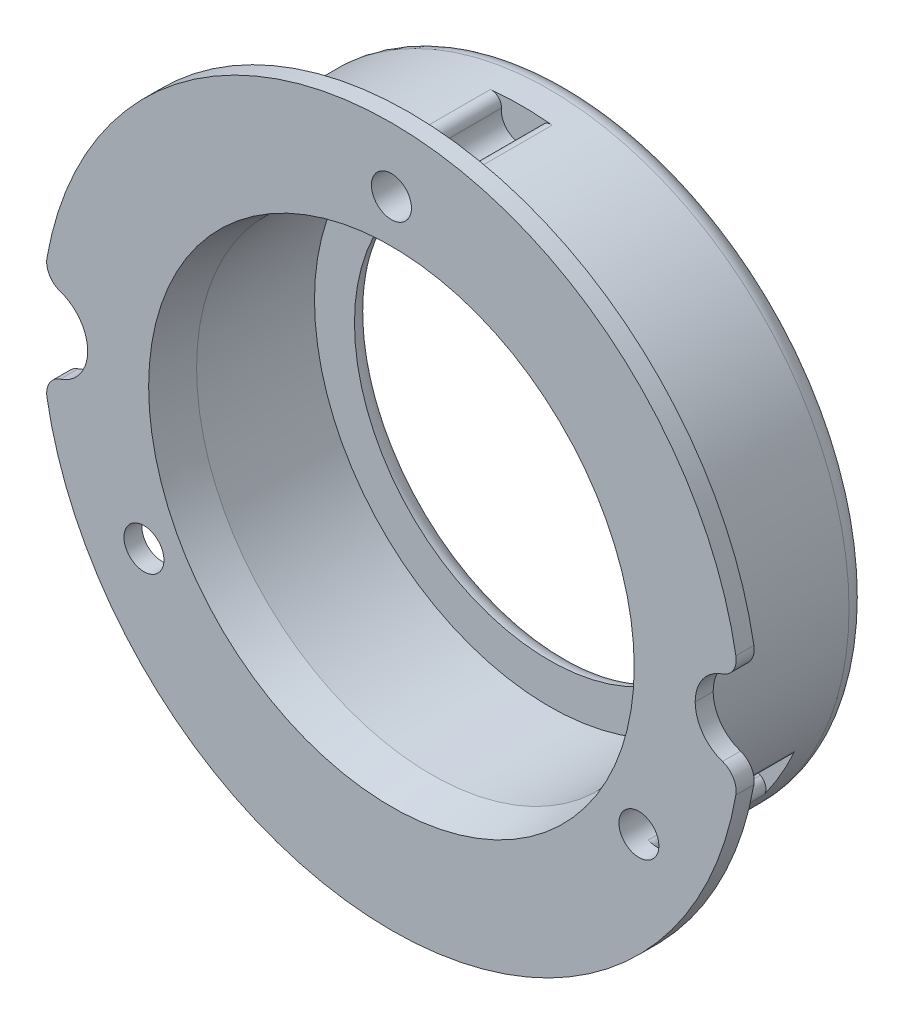
from build123d import *

# Parameters (mm, degrees)
SKETCH_1_R               = 15
SKETCH_1_R_2             = 11.75
EXTRUDE_1_DEPTH          = 4
SKETCH_2_R               = 11.75
SKETCH_2_R_2             = 9.75
EXTRUDE_2_DEPTH          = 1
FILLET_1_R               = 1
FILLET_2_R               = 1
SKETCH_3_R               = 17.5
SKETCH_3_R_2             = 11.75
EXTRUDE_3_DEPTH          = 0.9
CUT_EXTRUDE_1_DEPTH      = 27.009613607
FILLET_3_R               = 2
FILLET_4_R               = 1
SKETCH_6_R               = 1
CUT_EXTRUDE_2_DEPTH      = 6.5
PATTERN_CIRCULAR_2_COUNT = 3
FILLET_6_R               = 0.5
CHAMFER_1_SIZE           = 0.4
CHAMFER_1_SIZE2          = 2


# Some blends are built 0.0001 mm under size
with BuildPart() as part:
    # 草图1 → 凸台-拉伸1 (new, symmetric)
    with BuildSketch(Plane.XY):
        Circle(SKETCH_1_R)
        Circle(SKETCH_1_R_2, mode=Mode.SUBTRACT)
    extrude(amount=EXTRUDE_1_DEPTH, both=True)

    # 草图2 → 凸台-拉伸2 (add)
    with BuildSketch(Plane(origin=(0, 0, -4), x_dir=(-1, 0, 0), z_dir=(0, 0, -1))):
        Circle(SKETCH_2_R)
        Circle(SKETCH_2_R_2, mode=Mode.SUBTRACT)
    extrude(amount=-EXTRUDE_2_DEPTH)

    # 圆角1
    fillet_1_edges = [part.edges().sort_by_distance(p)[0] for p in [
        (-15, 0, -4),
    ]]
    fillet(fillet_1_edges, radius=FILLET_1_R)

    # 圆角2
    fillet_2_edges = [part.edges().sort_by_distance(p)[0] for p in [
        (9.75, 0, -4),
    ]]
    fillet(fillet_2_edges, radius=FILLET_2_R - 0.0001)  # a hair under: the kernel refuses the full size

    # 草图3 → 凸台-拉伸3 (add)
    with BuildSketch(Plane.XY.offset(4)):
        Circle(SKETCH_3_R)
        with Locations(Location((0, 0, 0), (0, 0, 180))):
            Circle(SKETCH_3_R_2, mode=Mode.SUBTRACT)
    extrude(amount=EXTRUDE_3_DEPTH)

    # 草图4 → 切除-拉伸1 (cut, through all)
    with BuildSketch(Plane(origin=(0, 0, 4), x_dir=(-1, 0, 0), z_dir=(0, 0, -1))):
        with BuildLine():
            Line((-20.056660766, 2), (-15.067846561, 2))
            ThreePointArc((-15.067846561, 2), (-15.2, 0), (-15.067846561, -2))
            Line((-15.067846561, -2), (-20.056660766, -2))
            Line((-20.056660766, -2), (-20.056660766, 2))
        make_face()
    cut_extrude_1 = extrude(amount=-CUT_EXTRUDE_1_DEPTH, mode=Mode.SUBTRACT)

    # 镜向1: 切除-拉伸1 across plane
    add(cut_extrude_1.mirror(Plane(origin=(0, 0, 0), x_dir=(0, 0, 1), z_dir=(1, 0, 0))), mode=Mode.SUBTRACT)

    # 圆角3
    fillet_3_edges = [part.edges().sort_by_distance(p)[0] for p in [
        (-15.067846561, -2, 4.45),
        (-15.067846561, 2, 4.45),
        (15.067846561, -2, 4.45),
        (15.067846561, 2, 4.45),
    ]]
    fillet(fillet_3_edges, radius=FILLET_3_R - 0.0001)  # a hair under: the kernel refuses the full size

    # 圆角4
    fillet_4_edges = [part.edges().sort_by_distance(p)[0] for p in [
        (17.385338651, 2, 4.45),
        (17.385338651, -2, 4.45),
        (-17.385338651, -2, 4.45),
        (-17.385338651, 2, 4.45),
    ]]
    fillet(fillet_4_edges, radius=FILLET_4_R)

    # 草图6 → 切除-拉伸2 (cut)
    with BuildSketch(Plane.XY.offset(4.9)):
        with Locations((0, 14.3)):
            Circle(SKETCH_6_R)
    cut_extrude_2 = extrude(amount=-CUT_EXTRUDE_2_DEPTH, mode=Mode.SUBTRACT)

    # 阵列(圆周)2: 切除-拉伸2 ×3 about axis
    pattern_circular_2_axis = Axis((0, 0, 0), (0, 0, 1))
    for i in range(1, PATTERN_CIRCULAR_2_COUNT):
        add(cut_extrude_2.rotate(pattern_circular_2_axis, i * 360 / PATTERN_CIRCULAR_2_COUNT), mode=Mode.SUBTRACT)

    # 圆角6
    # the kernel refuses this fillet: 0.5 mm, written as the material it takes off along each edge
    with BuildSketch(Plane(origin=(-0.73119563, 14.982167832, -1.6), x_dir=(-0.997111465428935, -0.07595212643607639, 0), z_dir=(0, 0, 1)), Plane(origin=(13.340535761, -6.857849926, -1.6), x_dir=(0.4327792617493751, 0.9014999226842262, 0), z_dir=(0, 0, 1)), Plane(origin=(-12.609340132, -8.124317906, -1.6), x_dir=(0.5643322036795584, -0.8255477962481478, 0), z_dir=(0, 0, 1))) as fillet_6_piece_1:
        with BuildLine():
            CenterArc((0.804059787, 0.49981424), FILLET_6_R, 170.950986261, 100.610876057)
            ThreePointArc((0.310282709, 0.578453903), (0.203956844, 0.26304232), (0, 0))
            ThreePointArc((0, 0), (0.40884396, -0.005572815), (0.817687919, 0))
        make_face()
    extrude(amount=5.6, mode=Mode.SUBTRACT)
    with BuildSketch(Plane(origin=(0.73119563, 14.982167832, -1.6), x_dir=(0.997111465428935, -0.07595212643607635, 0), z_dir=(0, 0, 1)), Plane(origin=(12.609340132, -8.124317906, -1.6), x_dir=(-0.5643322036795624, -0.825547796248145, 0), z_dir=(0, 0, 1)), Plane(origin=(-13.340535761, -6.857849926, -1.6), x_dir=(-0.4327792617493753, 0.9014999226842261, 0), z_dir=(0, 0, 1))) as fillet_6_piece_2:
        with BuildLine():
            CenterArc((0.804059787, -0.49981424), FILLET_6_R, 88.438137682, 100.610876057)
            ThreePointArc((0.310282709, -0.578453903), (0.203956844, -0.26304232), (0, 0))
            ThreePointArc((0, 0), (0.40884396, 0.005572815), (0.817687919, 0))
        make_face()
    extrude(amount=5.6, mode=Mode.SUBTRACT)

    # 倒角1
    chamfer_1_edges = [part.edges().sort_by_distance(p)[0] for p in [
        (11.75, 0, 4.9),
    ]]
    chamfer_1_side = [part.faces().sort_by_distance(p)[0] for p in [
        (15.179125182, 1.457318687, 4.9),
    ]]
    chamfer(chamfer_1_edges, length=CHAMFER_1_SIZE, length2=CHAMFER_1_SIZE2, reference=chamfer_1_side[0])


solid = part.part
